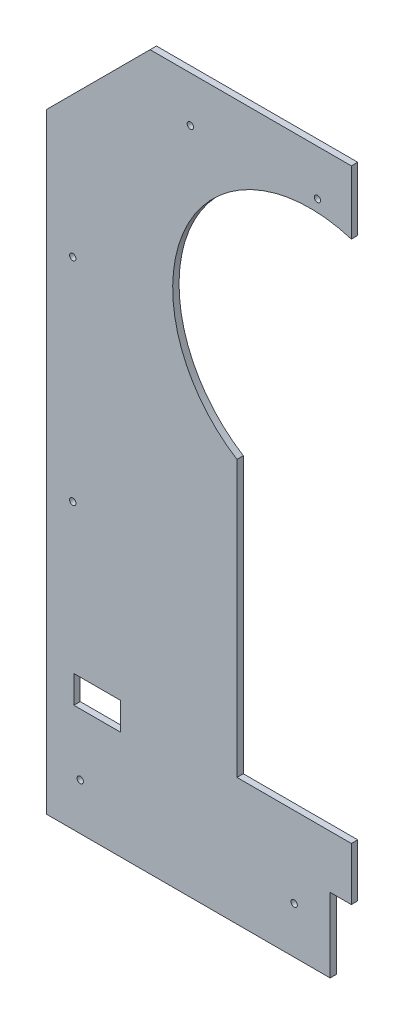
from build123d import *

# Parameters (mm, degrees)
ESQUISSE1_W                  = 144
ESQUISSE1_H                  = 337
BOSS_EXTRU_1_DEPTH           = 3
ESQUISSE2_R                  = 1.5
ENL_V_MAT_EXTRU_1_DEPTH      = 367.488744711
CHANFREIN1_SIZE              = 49
ENL_V_MAT_EXTRU_2_DEPTH      = 367.488744711
ENL_V_MAT_EXTRU_2_DEPTH_BACK = 367.488744711
ESQUISSE3_W                  = 10
ESQUISSE3_H                  = 35
ESQUISSE4_W                  = 22
ESQUISSE4_H                  = 13
ENL_V_MAT_EXTRU_3_DEPTH      = 367.488744711
ENL_V_MAT_EXTRU_4_DEPTH      = 367.488744711


with BuildPart() as part:
    # Esquisse1 → Boss.-Extru.1 (new body)
    with BuildSketch(Plane.XY):
        with Locations((72, 168.5)):
            Rectangle(ESQUISSE1_W, ESQUISSE1_H)
    extrude(amount=BOSS_EXTRU_1_DEPTH)

    # Esquisse2 → Enlèv. mat.-Extru.1 (cut, through all)
    with BuildSketch(Plane.XY.offset(3)):
        with Locations((16, 22)):
            Circle(ESQUISSE2_R)
        with Locations((12.5, 234)):
            Circle(ESQUISSE2_R)
        with Locations((12.5, 134)):
            Circle(ESQUISSE2_R)
        with Locations((68, 315.5)):
            Circle(ESQUISSE2_R)
        with Locations((128, 315.5)):
            Circle(ESQUISSE2_R)
        with Locations((117, 22)):
            Circle(ESQUISSE2_R)
    extrude(amount=-ENL_V_MAT_EXTRU_1_DEPTH, mode=Mode.SUBTRACT)

    # Chanfrein1
    chanfrein1_edges = [part.edges().sort_by_distance(p)[0] for p in [
        (0, 337, 1.5),
    ]]
    chamfer(chanfrein1_edges, length=CHANFREIN1_SIZE)

    # Esquisse3 → Enlèv. mat.-Extru.2 (cut, two sides: drawn at the far end of the back side and taken through both)
    with BuildSketch(Plane.XY.offset(3).offset(-ENL_V_MAT_EXTRU_2_DEPTH_BACK)):
        with Locations((139, 17.5)):
            Rectangle(ESQUISSE3_W, ESQUISSE3_H)
    extrude(amount=ENL_V_MAT_EXTRU_2_DEPTH + ENL_V_MAT_EXTRU_2_DEPTH_BACK, mode=Mode.SUBTRACT)

    # Esquisse4 → Enlèv. mat.-Extru.3 (cut, through all)
    with BuildSketch(Plane.XY.offset(3)):
        with Locations((24, 57.5)):
            Rectangle(ESQUISSE4_W, ESQUISSE4_H)
    extrude(amount=-ENL_V_MAT_EXTRU_3_DEPTH, mode=Mode.SUBTRACT)

    # Esquisse5 → Enlèv. mat.-Extru.4 (cut, through all)
    with BuildSketch(Plane.XY.offset(3)):
        with BuildLine():
            Line((144, 60), (90, 60))
            Line((90, 60), (90, 190))
            ThreePointArc((90, 190), (65.640981051, 272.217096705), (144, 307.043479577))
            Line((144, 307.043479577), (144, 60))
        make_face()
    extrude(amount=-ENL_V_MAT_EXTRU_4_DEPTH, mode=Mode.SUBTRACT)


solid = part.part
